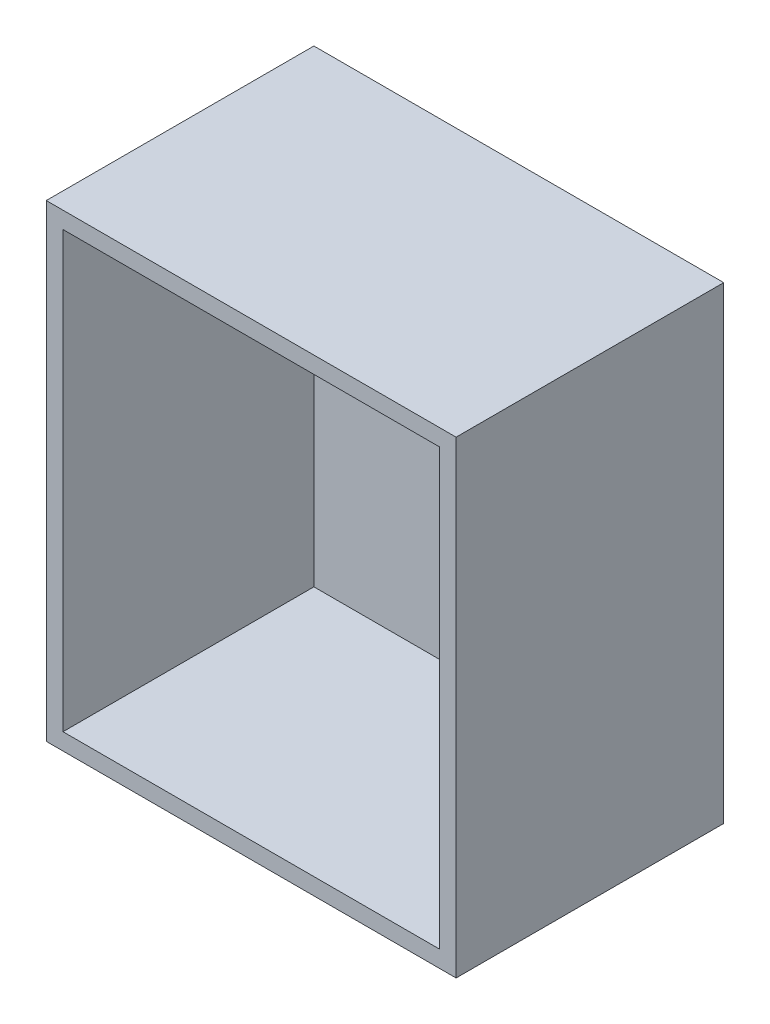
from build123d import *

# Parameters (mm, degrees)
SCHIZZO1_W                   = 49
SCHIZZO1_H                   = 56
ESTRUSIONE_ESTRUSIONE1_DEPTH = 2
SCHIZZO3_W                   = 49
SCHIZZO3_H                   = 2
ESTRUSIONE_ESTRUSIONE2_DEPTH = 30
SCHIZZO4_W                   = 2
SCHIZZO4_H                   = 54
ESTRUSIONE_ESTRUSIONE3_DEPTH = 30
SCHIZZO5_W                   = 47
SCHIZZO5_H                   = 2
ESTRUSIONE_ESTRUSIONE4_DEPTH = 30
SCHIZZO6_W                   = 2
SCHIZZO6_H                   = 52
ESTRUSIONE_ESTRUSIONE5_DEPTH = 30
SCHIZZO7_W                   = 25
SCHIZZO7_H                   = 3
ESTRUSIONE_ESTRUSIONE6_DEPTH = 13.3
SCHIZZO9_W                   = 3.5
SCHIZZO9_H                   = 52
ESTRUSIONE_ESTRUSIONE7_DEPTH = 13.3
SCHIZZO10_W                  = 4
SCHIZZO10_H                  = 1.5
TAGLIO_ESTRUSIONE1_DEPTH     = 6
SCHIZZO11_W                  = 1.5
SCHIZZO11_H                  = 1.5
TAGLIO_ESTRUSIONE2_DEPTH     = 6
SCHIZZO12_W                  = 4
SCHIZZO12_H                  = 1
TAGLIO_ESTRUSIONE3_DEPTH     = 0.75
SCHIZZO13_W                  = 4
SCHIZZO13_H                  = 1
TAGLIO_ESTRUSIONE4_DEPTH     = 0.75
SCHIZZO14_W                  = 4
SCHIZZO14_H                  = 1
TAGLIO_ESTRUSIONE5_DEPTH     = 0.75
SCHIZZO15_W                  = 4
SCHIZZO15_H                  = 1
TAGLIO_ESTRUSIONE6_DEPTH     = 0.75
SCHIZZO21_W                  = 1
SCHIZZO21_H                  = 1.5
TAGLIO_ESTRUSIONE7_DEPTH     = 1
SCHIZZO23_W                  = 2.5
SCHIZZO23_H                  = 0.75
TAGLIO_ESTRUSIONE8_DEPTH     = 1
SCHIZZO24_W                  = 2.496840505
SCHIZZO24_H                  = 0.75
TAGLIO_ESTRUSIONE9_DEPTH     = 1
SCHIZZO26_W                  = 1.003159495
SCHIZZO26_H                  = 3
TAGLIO_ESTRUSIONE10_DEPTH    = 1
SCHIZZO27_W                  = 1
SCHIZZO27_H                  = 3
TAGLIO_ESTRUSIONE11_DEPTH    = 1
SCHIZZO28_W                  = 3.5
SCHIZZO28_H                  = 4
TAGLIO_ESTRUSIONE12_DEPTH    = 1
SCHIZZO33_W                  = 3.5
SCHIZZO33_H                  = 4
TAGLIO_ESTRUSIONE16_DEPTH    = 1


with BuildPart() as part:
    # Schizzo1 → Estrusione-Estrusione1 (new body)
    with BuildSketch(Plane.XY):
        with Locations((24.5, 28)):
            Rectangle(SCHIZZO1_W, SCHIZZO1_H)
    extrude(amount=ESTRUSIONE_ESTRUSIONE1_DEPTH)

    # Schizzo3 → Estrusione-Estrusione2 (add)
    with BuildSketch(Plane.XY.offset(2)):
        with Locations((24.5, 55)):
            Rectangle(SCHIZZO3_W, SCHIZZO3_H)
    extrude(amount=ESTRUSIONE_ESTRUSIONE2_DEPTH)

    # Schizzo4 → Estrusione-Estrusione3 (add)
    with BuildSketch(Plane.XY.offset(2)):
        with Locations((48, 27)):
            Rectangle(SCHIZZO4_W, SCHIZZO4_H)
    extrude(amount=ESTRUSIONE_ESTRUSIONE3_DEPTH)

    # Schizzo5 → Estrusione-Estrusione4 (add)
    with BuildSketch(Plane.XY.offset(2)):
        with Locations((23.5, 1)):
            Rectangle(SCHIZZO5_W, SCHIZZO5_H)
    extrude(amount=ESTRUSIONE_ESTRUSIONE4_DEPTH)

    # Schizzo6 → Estrusione-Estrusione5 (add)
    with BuildSketch(Plane.XY.offset(2)):
        with Locations((1, 28)):
            Rectangle(SCHIZZO6_W, SCHIZZO6_H)
    extrude(amount=ESTRUSIONE_ESTRUSIONE5_DEPTH)

    # Schizzo7 → Estrusione-Estrusione6 (add)
    with BuildSketch(Plane.XY.offset(2)):
        with Locations((14.5, 45.2)):
            Rectangle(SCHIZZO7_W, SCHIZZO7_H)
    extrude(amount=ESTRUSIONE_ESTRUSIONE6_DEPTH)

    # Schizzo9 → Estrusione-Estrusione7 (add)
    with BuildSketch(Plane.XY.offset(2)):
        with Locations((45.25, 28)):
            Rectangle(SCHIZZO9_W, SCHIZZO9_H)
    extrude(amount=ESTRUSIONE_ESTRUSIONE7_DEPTH)

    # Schizzo10 → Taglio-Estrusione1 (cut)
    with BuildSketch(Plane.XY.offset(15.3)):
        with Locations((6, 45.2)):
            Rectangle(SCHIZZO10_W, SCHIZZO10_H)
        with Locations((24, 45.2)):
            Rectangle(SCHIZZO10_W, SCHIZZO10_H)
    extrude(amount=-TAGLIO_ESTRUSIONE1_DEPTH, mode=Mode.SUBTRACT)

    # Schizzo11 → Taglio-Estrusione2 (cut)
    with BuildSketch(Plane.XY.offset(15.3)):
        with Locations((45.25, 45.2)):
            Rectangle(SCHIZZO11_W, SCHIZZO11_H)
    extrude(amount=-TAGLIO_ESTRUSIONE2_DEPTH, mode=Mode.SUBTRACT)

    # Schizzo12 → Taglio-Estrusione3 (cut)
    with BuildSketch(Plane(origin=(0, 45.95, 0), x_dir=(-1, 0, 0), z_dir=(0, -1, 0))):
        with Locations((-6, -14.8)):
            Rectangle(SCHIZZO12_W, SCHIZZO12_H)
    extrude(amount=-TAGLIO_ESTRUSIONE3_DEPTH, mode=Mode.SUBTRACT)

    # Schizzo13 → Taglio-Estrusione4 (cut)
    with BuildSketch(Plane(origin=(0, 44.45, 0), x_dir=(1, 0, 0), z_dir=(0, 1, 0))):
        with Locations((6, -14.8)):
            Rectangle(SCHIZZO13_W, SCHIZZO13_H)
    extrude(amount=-TAGLIO_ESTRUSIONE4_DEPTH, mode=Mode.SUBTRACT)

    # Schizzo14 → Taglio-Estrusione5 (cut)
    with BuildSketch(Plane(origin=(0, 45.95, 0), x_dir=(-1, 0, 0), z_dir=(0, -1, 0))):
        with Locations((-24, -14.8)):
            Rectangle(SCHIZZO14_W, SCHIZZO14_H)
    extrude(amount=-TAGLIO_ESTRUSIONE5_DEPTH, mode=Mode.SUBTRACT)

    # Schizzo15 → Taglio-Estrusione6 (cut)
    with BuildSketch(Plane(origin=(0, 44.45, 0), x_dir=(1, 0, 0), z_dir=(0, 1, 0))):
        with Locations((24, -14.8)):
            Rectangle(SCHIZZO15_W, SCHIZZO15_H)
    extrude(amount=-TAGLIO_ESTRUSIONE6_DEPTH, mode=Mode.SUBTRACT)

    # Schizzo21 → Taglio-Estrusione7 (cut)
    with BuildSketch(Plane.XY.offset(15.3)):
        with Locations((44, 45.2)):
            Rectangle(SCHIZZO21_W, SCHIZZO21_H)
    extrude(amount=-TAGLIO_ESTRUSIONE7_DEPTH, mode=Mode.SUBTRACT)

    # Schizzo23 → Taglio-Estrusione8 (cut)
    with BuildSketch(Plane.XY.offset(15.3)):
        with Locations((44.75, 46.325)):
            Rectangle(SCHIZZO23_W, SCHIZZO23_H)
    extrude(amount=-TAGLIO_ESTRUSIONE8_DEPTH, mode=Mode.SUBTRACT)

    # Schizzo24 → Taglio-Estrusione9 (cut)
    with BuildSketch(Plane.XY.offset(15.3)):
        with Locations((44.748420252, 44.075)):
            Rectangle(SCHIZZO24_W, SCHIZZO24_H)
    extrude(amount=-TAGLIO_ESTRUSIONE9_DEPTH, mode=Mode.SUBTRACT)

    # Schizzo26 → Taglio-Estrusione10 (cut)
    with BuildSketch(Plane.XY.offset(15.3)):
        with Locations((46.498420252, 45.2)):
            Rectangle(SCHIZZO26_W, SCHIZZO26_H)
    extrude(amount=-TAGLIO_ESTRUSIONE10_DEPTH, mode=Mode.SUBTRACT)

    # Schizzo27 → Taglio-Estrusione11 (cut)
    with BuildSketch(Plane.XY.offset(15.3)):
        with Locations((26.5, 45.2)):
            Rectangle(SCHIZZO27_W, SCHIZZO27_H)
    extrude(amount=-TAGLIO_ESTRUSIONE11_DEPTH, mode=Mode.SUBTRACT)

    # Schizzo28 → Taglio-Estrusione12 (cut)
    with BuildSketch(Plane.XY.offset(15.3)):
        with Locations((45.25, 15.3)):
            Rectangle(SCHIZZO28_W, SCHIZZO28_H)
    extrude(amount=-TAGLIO_ESTRUSIONE12_DEPTH, mode=Mode.SUBTRACT)

    # Schizzo33 → Taglio-Estrusione16 (cut)
    with BuildSketch(Plane.XY.offset(15.3)):
        with Locations((45.25, 30.5)):
            Rectangle(SCHIZZO33_W, SCHIZZO33_H)
    extrude(amount=-TAGLIO_ESTRUSIONE16_DEPTH, mode=Mode.SUBTRACT)


solid = part.part
